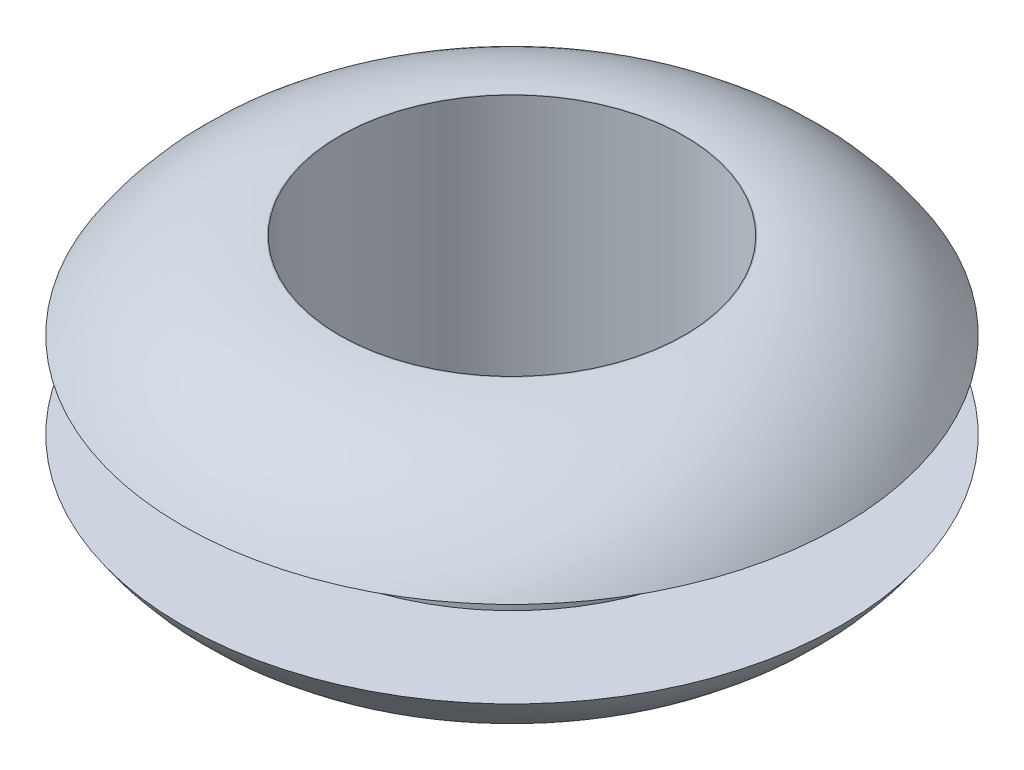
from build123d import *

# Parameters (mm, degrees)
SKETCH1_R           = 7.65
SKETCH1_R_2         = 4
BOSS_EXTRUDE1_DEPTH = 6
SKETCH2_R           = 7.65
SKETCH2_R_2         = 5
CUT_EXTRUDE1_DEPTH  = 1
FILLET1_R           = 4.3


with BuildPart() as part:
    # Sketch1 → Boss-Extrude1 (new body)
    with BuildSketch(Plane(origin=(0, 0, 0), x_dir=(1, 0, 0), z_dir=(0, 1, 0))):
        with Locations(Location((0, 0, 0), (0, 0, 270))):
            Circle(SKETCH1_R)
        with Locations(Location((0, 0, 0), (0, 0, 270))):
            Circle(SKETCH1_R_2, mode=Mode.SUBTRACT)
    extrude(amount=BOSS_EXTRUDE1_DEPTH)

    # Sketch2 → Cut-Extrude1 (cut, symmetric)
    with BuildSketch(Plane(origin=(0, 3, 0), x_dir=(1, 0, 0), z_dir=(0, 1, 0))):
        with Locations(Location((0, 0, 0), (0, 0, 270))):
            Circle(SKETCH2_R)
        with Locations(Location((0, 0, 0), (0, 0, 270))):
            Circle(SKETCH2_R_2, mode=Mode.SUBTRACT)
    extrude(amount=CUT_EXTRUDE1_DEPTH, both=True, mode=Mode.SUBTRACT)

    # Fillet1
    # the kernel refuses this fillet: 4.3 mm, written as the material it takes off along each edge
    with BuildSketch(Plane(origin=(0, 0, 0), x_dir=(0, 0, 1), z_dir=(-1, 0, 0))) as fillet1_piece_1:
        with BuildLine():
            CenterArc((4.016819575, 4.3), FILLET1_R, 270, 57.663974002)
            Line((4.016819575, 0), (7.65, 0))
            Line((7.65, 0), (7.65, 2))
        make_face()
    revolve(axis=Axis((0, 0, 0), (0, 1, 0)), mode=Mode.SUBTRACT)
    with BuildSketch(Plane(origin=(0, 6, 0), x_dir=(0, 0, 1), z_dir=(-1, 0, 0))) as fillet1_piece_2:
        with BuildLine():
            CenterArc((4.016819575, -4.3), FILLET1_R, 32.336025998, 57.663974002)
            Line((7.65, -2), (7.65, 0))
            Line((7.65, 0), (4.016819575, 0))
        make_face()
    revolve(axis=Axis((0, 6, 0), (0, 1, 0)), mode=Mode.SUBTRACT)


solid = part.part
